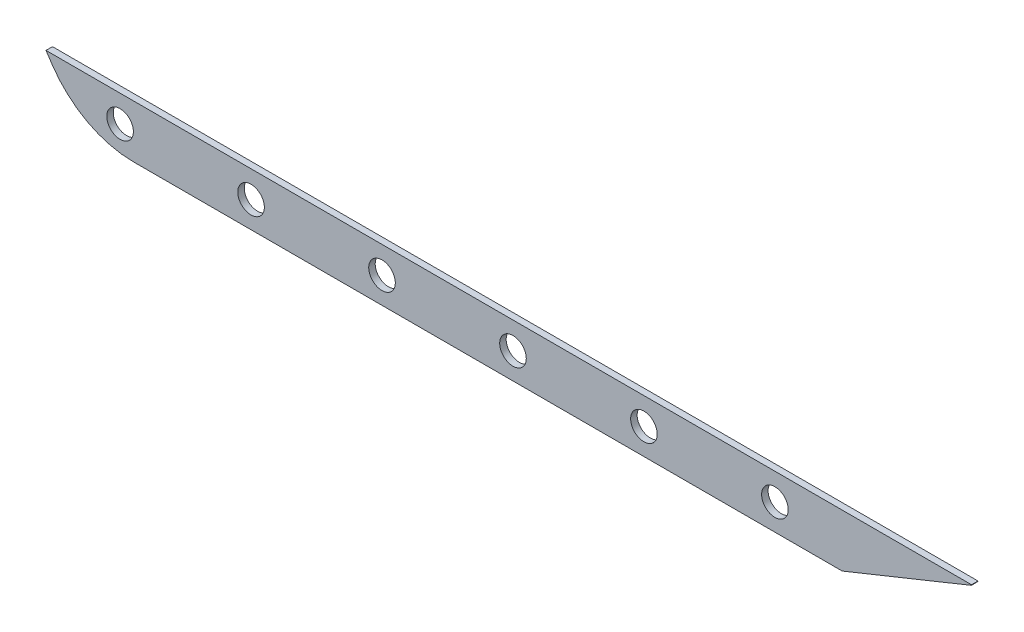
from build123d import *

# Parameters (mm, degrees)
BOSS_EXTRUDE1_DEPTH = 3.175
SKETCH1_4_R         = 6.5
CUT_EXTRUDE1_DEPTH  = 439.905857431
FILLET1_R           = 48
CUT_EXTRUDE3_DEPTH  = 10
CUT_EXTRUDE5_DEPTH  = 10


with BuildPart() as part:
    # Sketch1 → Boss-Extrude1 (new body)
    with BuildSketch(Plane.XY):
        Polygon((428.120588235, 28.939617947), (0.540381846, 28.939617947), (-115.605170134, 28.939617947), (-98.879411765, 3.850980392), (-31.879411765, -96.649019608), (366, -96.649019608), (403.120588235, -71.149019608), align=None)
    extrude(amount=BOSS_EXTRUDE1_DEPTH)

    # Sketch1<4> → Cut-Extrude1 (cut, through all)
    with BuildSketch(Plane.XY):
        with Locations((-12.879411765, -83.899019608)):
            Circle(SKETCH1_4_R)
        with Locations((51.120588235, -83.899019608)):
            Circle(SKETCH1_4_R)
        with Locations((115.120588235, -83.899019608)):
            Circle(SKETCH1_4_R)
        with Locations((179.120588235, -83.899019608)):
            Circle(SKETCH1_4_R)
        with Locations((243.120588235, -83.899019608)):
            Circle(SKETCH1_4_R)
        with Locations((307.120588235, -83.899019608)):
            Circle(SKETCH1_4_R)
    extrude(amount=CUT_EXTRUDE1_DEPTH, mode=Mode.SUBTRACT)

    # Fillet1
    fillet1_edges = [part.edges().sort_by_distance(p)[0] for p in [
        (-31.879411765, -96.649019608, 1.5875),
    ]]
    fillet(fillet1_edges, radius=FILLET1_R)

    # Sketch7 → Cut-Extrude3 (cut)
    with BuildSketch(Plane.XY.offset(3.175)):
        Polygon((403.120588235, -71.149019608), (340.005873473, -96.649019608), (366, -96.649019608), align=None)
    extrude(amount=-CUT_EXTRUDE3_DEPTH, mode=Mode.SUBTRACT)

    # Sketch10 → Cut-Extrude5 (cut)
    with BuildSketch(Plane.XY.offset(3.175)):
        Polygon((-49.086078431, -70.839019608), (403.198019602, -70.839019608), (428.120588235, 28.939617947), (-115.605170134, 28.939617947), align=None)
    extrude(amount=-CUT_EXTRUDE5_DEPTH, mode=Mode.SUBTRACT)


solid = part.part
